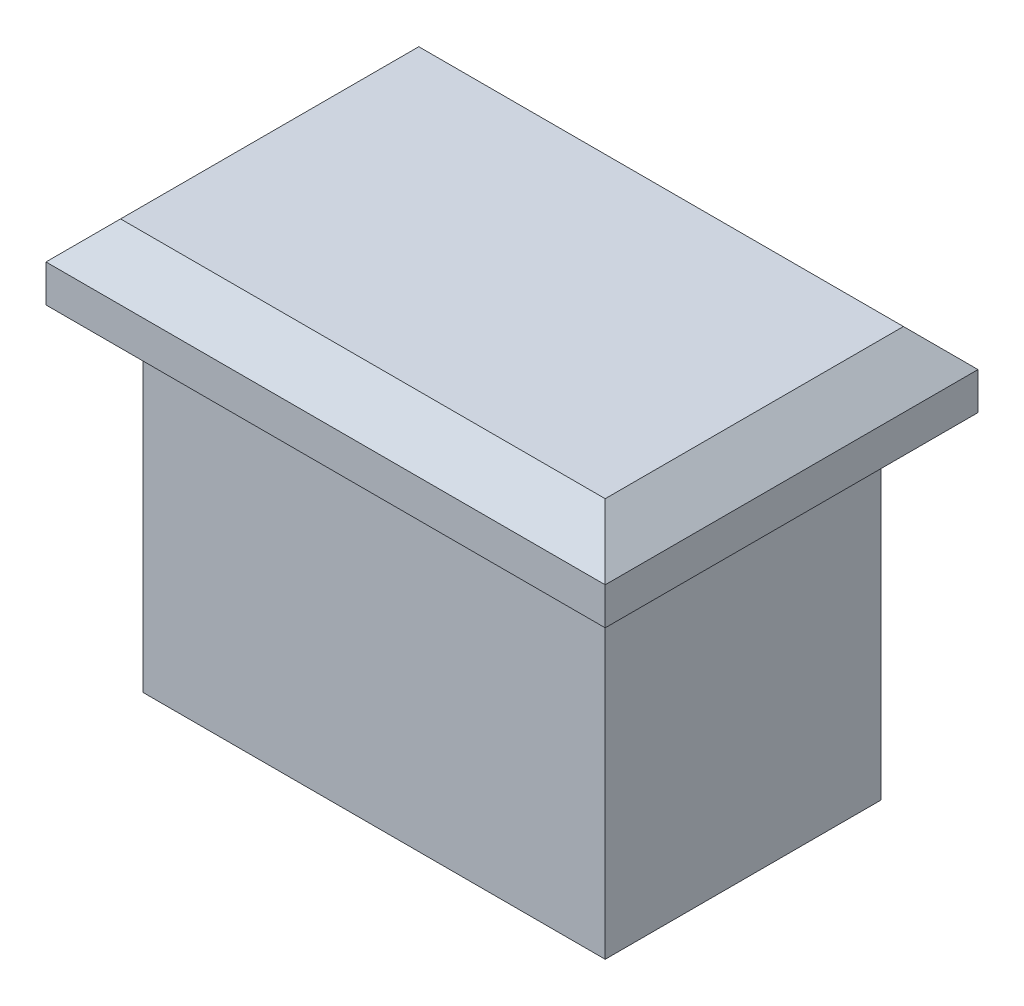
from build123d import *

# Parameters (mm, degrees)
SKETCH_1_W      = 15
SKETCH_1_H      = 10
EXTRUDE_1_DEPTH = 2
SKETCH_2_W      = 12.4
SKETCH_2_H      = 7.4
EXTRUDE_2_DEPTH = 10
CHAMFER_1_SIZE  = 1
CHAMFER_2_SIZE  = 1


with BuildPart() as part:
    # ｽｹｯﾁ1 → ﾎﾞｽ - 押し出し1 (new body)
    with BuildSketch(Plane(origin=(0, 0, 0), x_dir=(1, 0, 0), z_dir=(0, 1, 0))):
        Rectangle(SKETCH_1_W, SKETCH_1_H)
    extrude(amount=EXTRUDE_1_DEPTH)

    # ｽｹｯﾁ2 → ﾎﾞｽ - 押し出し2 (add)
    with BuildSketch(Plane.XZ):
        Rectangle(SKETCH_2_W, SKETCH_2_H)
    extrude(amount=EXTRUDE_2_DEPTH)

    # 面取り1
    chamfer_1_edges = [part.edges().sort_by_distance(p)[0] for p in [
        (6.2, -10, 0),
        (0, -10, -3.7),
        (-6.2, -10, 0),
        (0, -10, 3.7),
    ]]
    chamfer(chamfer_1_edges, length=CHAMFER_1_SIZE)

    # 面取り2
    chamfer_2_edges = [part.edges().sort_by_distance(p)[0] for p in [
        (0, 2, 5),
        (-7.5, 2, 0),
        (0, 2, -5),
        (7.5, 2, 0),
    ]]
    chamfer(chamfer_2_edges, length=CHAMFER_2_SIZE)


solid = part.part
